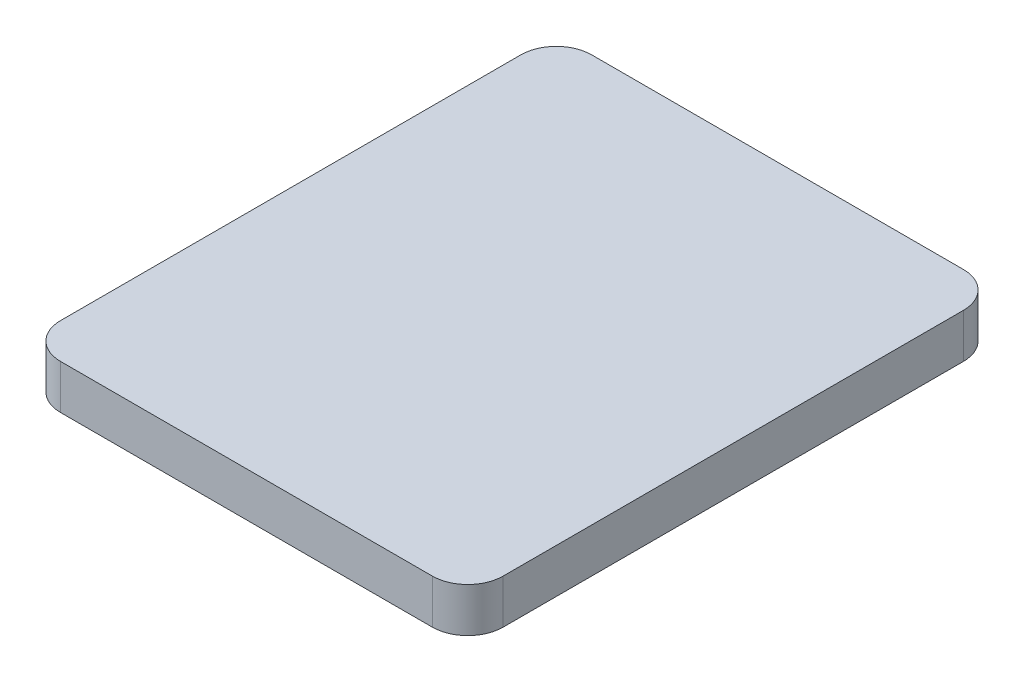
from build123d import *

# Parameters (mm, degrees)
SKETCH1_W           = 31.75
SKETCH1_H           = 38.1
BOSS_EXTRUDE1_DEPTH = 3.175
FILLET1_R           = 2.54


with BuildPart() as part:
    # Sketch1 → Boss-Extrude1 (new body)
    with BuildSketch(Plane(origin=(0, 0, 0), x_dir=(1, 0, 0), z_dir=(0, 1, 0))):
        with Locations((15.875, 19.05)):
            Rectangle(SKETCH1_W, SKETCH1_H)
    extrude(amount=BOSS_EXTRUDE1_DEPTH)

    # Fillet1
    fillet1_edges = [part.edges().sort_by_distance(p)[0] for p in [
        (0, 1.5875, -38.1),
        (31.75, 1.5875, -38.1),
        (31.75, 1.5875, 0),
        (0, 1.5875, 0),
    ]]
    fillet(fillet1_edges, radius=FILLET1_R)


solid = part.part
